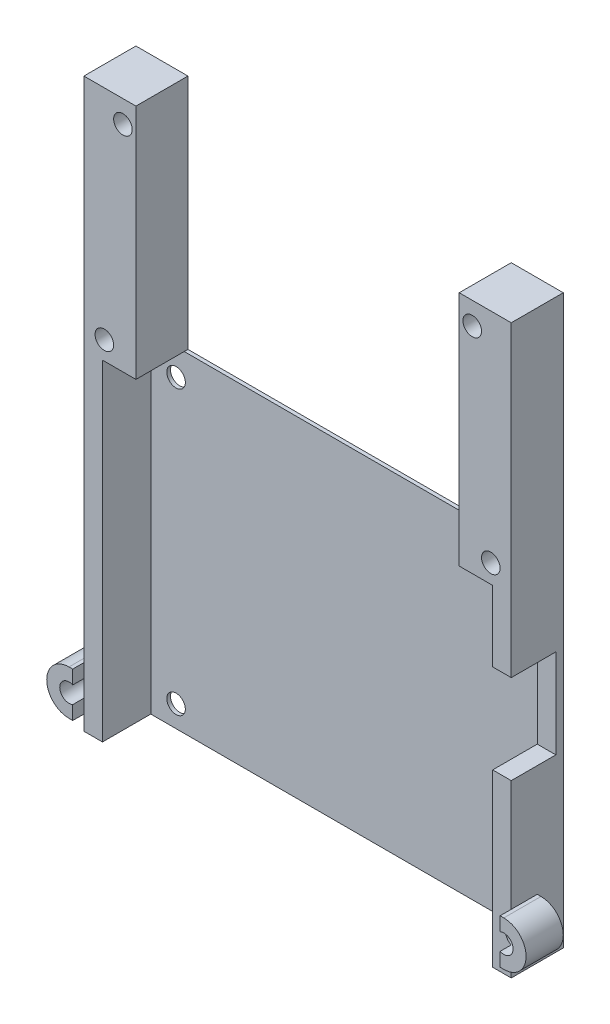
from build123d import *
from build123d.topology import SkipClean

# Parameters (mm, degrees)
BOSS_EXTRUDE1_DEPTH = 44.5
SKETCH2_W           = 6
SKETCH2_H           = 12
CUT_EXTRUDE1_DEPTH  = 10
BOSS_EXTRUDE2_DEPTH = 8.5
CUT_EXTRUDE2_DEPTH  = 11
SKETCH4_W           = 7
SKETCH4_H           = 7
BOSS_EXTRUDE3_DEPTH = 5
SKETCH9_W           = 7
SKETCH9_H           = 7
BOSS_EXTRUDE5_DEPTH = 26.85
SKETCH5_R           = 1.25
CUT_EXTRUDE3_DEPTH  = 84.316474961
SKETCH7_R           = 1.25
CUT_EXTRUDE4_DEPTH  = 10
CUT_EXTRUDE6_DEPTH  = 3.5
BOSS_EXTRUDE4_DEPTH = 3


with BuildPart() as part:
    # Sketch1 → Boss-Extrude1 (new body)
    with BuildSketch(Plane(origin=(0, 0, 0), x_dir=(1, 0, 0), z_dir=(0, 1, 0))):
        Polygon((-28.75, 0), (-26.25, 0), (-26.25, 6.5), (26.25, 6.5), (26.25, 0), (28.75, 0), (28.75, 7), (-28.75, 7), align=None)
    extrude(amount=BOSS_EXTRUDE1_DEPTH)

    # Sketch2 → Cut-Extrude1 (cut)
    with BuildSketch(Plane(origin=(28.75, 0, 0), x_dir=(0, 0, -1), z_dir=(1, 0, 0))):
        with Locations((3, 29)):
            Rectangle(SKETCH2_W, SKETCH2_H)
    extrude(amount=-CUT_EXTRUDE1_DEPTH, mode=Mode.SUBTRACT)

    # Sketch3 → Boss-Extrude2 (add)
    with BuildSketch(Plane(origin=(0, 0, -7), x_dir=(-1, 0, 0), z_dir=(0, 0, -1))):
        with BuildLine():
            Line((-28.75, 6.145643924), (-28.75, 8))
            Line((-28.75, 8), (-29.25, 8))
            ThreePointArc((-29.25, 8), (-32.25, 5), (-29.25, 2))
            Line((-29.25, 2), (-28.75, 2))
            Line((-28.75, 2), (-28.75, 3.854356076))
            ThreePointArc((-28.75, 3.854356076), (-30.5, 5), (-28.75, 6.145643924))
        make_face()
        with BuildLine():
            Line((28.75, 3.854356076), (28.75, 2))
            Line((28.75, 2), (29.25, 2))
            ThreePointArc((29.25, 2), (32.25, 5), (29.25, 8))
            Line((29.25, 8), (28.75, 8))
            Line((28.75, 8), (28.75, 6.145643924))
            ThreePointArc((28.75, 6.145643924), (30.5, 5), (28.75, 3.854356076))
        make_face()
    extrude(amount=-BOSS_EXTRUDE2_DEPTH)

    # Sketch3<3> → Cut-Extrude2 (cut)
    with SkipClean():  # the faces are left unmerged after this step: merging them gives an invalid solid
        with BuildSketch(Plane(origin=(0, 0, -7), x_dir=(-1, 0, 0), z_dir=(0, 0, -1))):
            with BuildLine():
                ThreePointArc((-28, 5), (-28.204174967, 5.684653197), (-28.75, 6.145643924))
                Line((-28.75, 6.145643924), (-28.75, 3.854356076))
                ThreePointArc((-28.75, 3.854356076), (-28.204174967, 4.315346803), (-28, 5))
            make_face()
        extrude(amount=-CUT_EXTRUDE2_DEPTH, mode=Mode.SUBTRACT)

    # Sketch4 → Boss-Extrude3 (add)
    with SkipClean():  # the faces are left unmerged after this step: merging them gives an invalid solid
        with BuildSketch(Plane(origin=(0, 44.5, 0), x_dir=(1, 0, 0), z_dir=(0, 1, 0))):
            with Locations((-25.25, 3.5)):
                Rectangle(SKETCH4_W, SKETCH4_H)
            with Locations((25.25, 3.5)):
                Rectangle(SKETCH4_W, SKETCH4_H)
        extrude(amount=BOSS_EXTRUDE3_DEPTH)

    # Sketch9 → Boss-Extrude5 (add)
    with SkipClean():  # the faces are left unmerged after this step: merging them gives an invalid solid
        with BuildSketch(Plane(origin=(0, 49.5, 0), x_dir=(1, 0, 0), z_dir=(0, 1, 0))):
            with Locations((25.25, 3.5)):
                Rectangle(SKETCH9_W, SKETCH9_H)
            with Locations((-25.25, 3.5)):
                Rectangle(SKETCH9_W, SKETCH9_H)
        extrude(amount=BOSS_EXTRUDE5_DEPTH)

    # Sketch5 → Cut-Extrude3 (cut, through all)
    with SkipClean():  # the faces are left unmerged after this step: merging them gives an invalid solid
        with BuildSketch(Plane(origin=(0, 0, -7), x_dir=(-1, 0, 0), z_dir=(0, 0, -1))):
            with Locations((-26, 47)):
                Circle(SKETCH5_R)
            with Locations((26, 47)):
                Circle(SKETCH5_R)
            with Locations((-23.5, 73.35)):
                Circle(SKETCH5_R)
            with Locations((23.5, 73.35)):
                Circle(SKETCH5_R)
        extrude(amount=-CUT_EXTRUDE3_DEPTH, mode=Mode.SUBTRACT)

    # Sketch7 → Cut-Extrude4 (cut)
    with SkipClean():  # the faces are left unmerged after this step: merging them gives an invalid solid
        with BuildSketch(Plane(origin=(0, 0, -7), x_dir=(-1, 0, 0), z_dir=(0, 0, -1))):
            with Locations((22.85, 2.9)):
                Circle(SKETCH7_R)
            with Locations((-22.85, 2.9)):
                Circle(SKETCH7_R)
            with Locations((-22.85, 40.95)):
                Circle(SKETCH7_R)
            with Locations((22.85, 40.95)):
                Circle(SKETCH7_R)
        extrude(amount=-CUT_EXTRUDE4_DEPTH, mode=Mode.SUBTRACT)

    # Sketch3<4> → Cut-Extrude6 (cut)
    with SkipClean():  # the faces are left unmerged after this step: merging them gives an invalid solid
        with BuildSketch(Plane(origin=(0, 0, -7), x_dir=(-1, 0, 0), z_dir=(0, 0, -1))):
            with BuildLine():
                Line((-28.75, 6.145643924), (-28.75, 8))
                Line((-28.75, 8), (-29.25, 8))
                ThreePointArc((-29.25, 8), (-32.25, 5), (-29.25, 2))
                Line((-29.25, 2), (-28.75, 2))
                Line((-28.75, 2), (-28.75, 3.854356076))
                ThreePointArc((-28.75, 3.854356076), (-30.5, 5), (-28.75, 6.145643924))
            make_face()
            with BuildLine():
                Line((28.75, 3.854356076), (28.75, 2))
                Line((28.75, 2), (29.25, 2))
                ThreePointArc((29.25, 2), (32.25, 5), (29.25, 8))
                Line((29.25, 8), (28.75, 8))
                Line((28.75, 8), (28.75, 6.145643924))
                ThreePointArc((28.75, 6.145643924), (30.5, 5), (28.75, 3.854356076))
            make_face()
        extrude(amount=-CUT_EXTRUDE6_DEPTH, mode=Mode.SUBTRACT)

    # Sketch3<5> → Boss-Extrude4 (add)
    with SkipClean():  # the faces are left unmerged after this step: merging them gives an invalid solid
        with BuildSketch(Plane(origin=(0, 0, -7), x_dir=(-1, 0, 0), z_dir=(0, 0, -1))):
            with BuildLine():
                ThreePointArc((-28, 5), (-28.204174967, 5.684653197), (-28.75, 6.145643924))
                Line((-28.75, 6.145643924), (-28.75, 3.854356076))
                ThreePointArc((-28.75, 3.854356076), (-28.204174967, 4.315346803), (-28, 5))
            make_face()
        extrude(amount=-BOSS_EXTRUDE4_DEPTH)


solid = part.part
